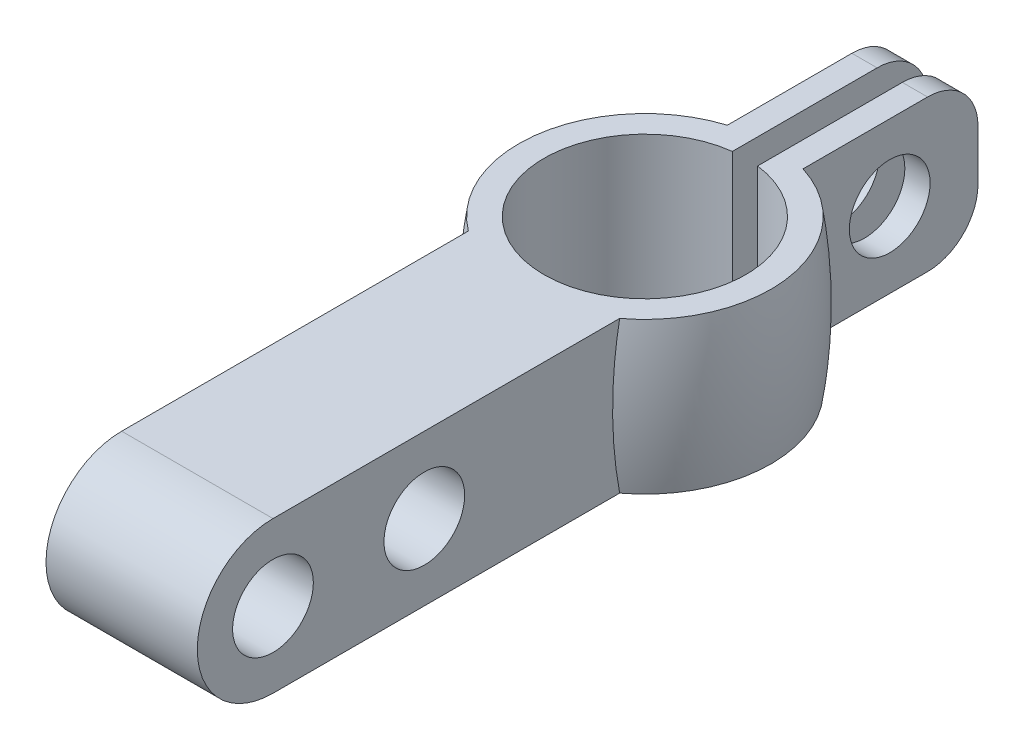
from build123d import *
from OCP.BRepAlgoAPI import BRepAlgoAPI_Cut
from OCP.TopTools import TopTools_ListOfShape

# Parameters (mm, degrees)
CUT_EXTRUDE_1_DEPTH      = 9.395352378
CUT_EXTRUDE_1_DEPTH_BACK = 9.395352378
SKETCH_2_W               = 3
SKETCH_2_H               = 3.541131468
EXTRUDE_START            = -2.0183
EXTRUDE_1_DEPTH          = 6
EXTRUDE_2_DEPTH          = 3
EXTRUDE_2_DEPTH_BACK     = 3
SKETCH_6_R               = 1.6
CUT_EXTRUDE_2_DEPTH      = 23.66980552
SKETCH_7_R               = 4
CUT_EXTRUDE_3_DEPTH      = 23.219551454
FILLET_1_R               = 2


with BuildPart() as part:
    # 草图1 → 旋转1 (revolve)
    with BuildSketch(Plane.XY, mode=Mode.PRIVATE) as revolve_1_sk:
        with BuildLine():
            Line((4, 3.981699636), (4, -2.018300364))
            Line((4, -2.018300364), (5, -2.018300364))
            ThreePointArc((5, -2.018300364), (5.226280067, 0.981699636), (5, 3.981699636))
            Line((5, 3.981699636), (4, 3.981699636))
        make_face()
    revolve(revolve_1_sk.sketch.rotate(Axis((0, -4.923271421, 0), (0, 1, 0)), 90), axis=Axis((0, -4.923271421, 0), (0, 1, 0)))

    # 草图2 → 切除-拉伸1 (cut, two sides: drawn at the far end of the back side and taken through both)
    with BuildSketch(Plane(origin=(0, 0, 0), x_dir=(1, 0, 0), z_dir=(0, 1, 0)).offset(-CUT_EXTRUDE_1_DEPTH_BACK)):
        with Locations((0, 5.060025588)):
            Rectangle(SKETCH_2_W, SKETCH_2_H)
    extrude(amount=CUT_EXTRUDE_1_DEPTH + CUT_EXTRUDE_1_DEPTH_BACK, mode=Mode.SUBTRACT)

    # 草图3 → 凸台-拉伸1 (add)
    with BuildSketch(Plane(origin=(0, 0, 0), x_dir=(1, 0, 0), z_dir=(0, 1, 0)).offset(EXTRUDE_START)):
        Polygon((-1.5, 3.708099244), (-0.5, 3.708099244), (-0.5, 11.708099244), (-1.5, 11.708099244), (-1.5, 4.981969012), align=None)
        Polygon((1.5, 11.708099244), (1.5, 4.981969012), (1.5, 3.708099244), (0.5, 3.708099244), (0.5, 11.708099244), align=None)
    extrude(amount=EXTRUDE_1_DEPTH)

    # 草图5 → 凸台-拉伸2 (add, two sides: drawn at the far end of the back side and taken through both)
    with BuildSketch(Plane(origin=(0, 0, 0), x_dir=(0, 0, -1), z_dir=(1, 0, 0)).offset(-EXTRUDE_2_DEPTH_BACK)):
        with BuildLine():
            Line((-3.745950378, 3.981699636), (-17.745950378, 3.981699636))
            ThreePointArc((-17.745950378, 3.981699636), (-20.745950378, 0.981699636), (-17.745950378, -2.018300364))
            Line((-17.745950378, -2.018300364), (-3.745950378, -2.018300364))
            Line((-3.745950378, -2.018300364), (-3.745950378, 3.981699636))
        make_face()
    extrude(amount=EXTRUDE_2_DEPTH + EXTRUDE_2_DEPTH_BACK)

    # 草图6 → 切除-拉伸2 (cut, through all)
    with BuildSketch(Plane(origin=(3, 0, 0), x_dir=(0, 0, -1), z_dir=(1, 0, 0))):
        with Locations((-17.745950378, 0.981699636)):
            Circle(SKETCH_6_R)
        with Locations((8.208099244, 0.981699636)):
            Circle(SKETCH_6_R)
        with Locations((-11.745950378, 0.981699636)):
            Circle(SKETCH_6_R)
    extrude(amount=-CUT_EXTRUDE_2_DEPTH, mode=Mode.SUBTRACT)


with BuildPart() as cut_extrude_3_tool:
    # 草图7 → 切除-拉伸3 (new, through all)
    with BuildSketch(Plane(origin=(0, 3.981699636, 0), x_dir=(1, 0, 0), z_dir=(0, 1, 0))):
        Circle(SKETCH_7_R)
    extrude(amount=-CUT_EXTRUDE_3_DEPTH)


with BuildPart() as part_1:
    add(part.part)

    # 切除-拉伸3: cut by cut_extrude_3_tool, with a tolerance
    cut_extrude_3_stock = TopTools_ListOfShape()
    cut_extrude_3_stock.Append(part_1.part.wrapped)
    cut_extrude_3_tools = TopTools_ListOfShape()
    cut_extrude_3_tools.Append(cut_extrude_3_tool.part.wrapped)
    cut_extrude_3_cut = BRepAlgoAPI_Cut()
    cut_extrude_3_cut.SetArguments(cut_extrude_3_stock)
    cut_extrude_3_cut.SetTools(cut_extrude_3_tools)
    cut_extrude_3_cut.SetFuzzyValue(0.00001)
    cut_extrude_3_cut.Build()
    add(Compound.cast(cut_extrude_3_cut.Shape()).solids(), mode=Mode.REPLACE)

    # 圆角1
    fillet_1_edges = [part_1.edges().sort_by_distance(p)[0] for p in [
        (-1, -2.0183, -11.708099244),
        (-1, 3.9817, -11.708099244),
        (1, -2.0183, -11.708099244),
        (1, 3.9817, -11.708099244),
    ]]
    fillet(fillet_1_edges, radius=FILLET_1_R)


solid = part_1.part
